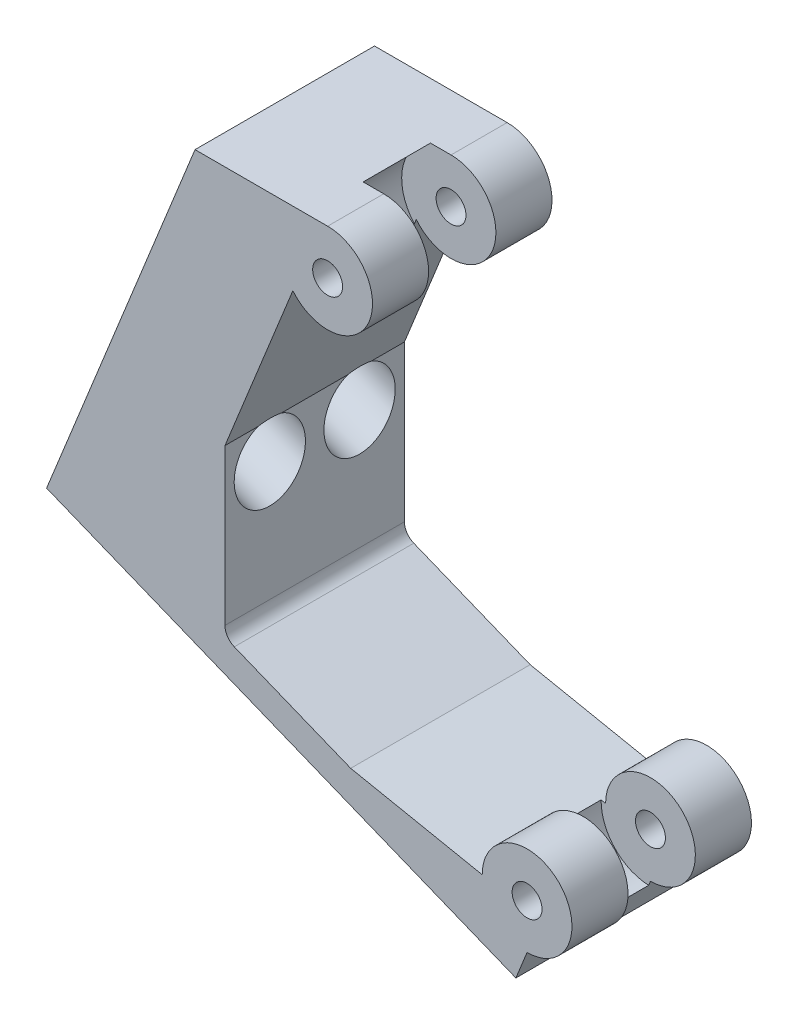
from build123d import *

# Parameters (mm, degrees)
SKETCH1_R                     = 1
BOSS_EXTRUDE1_DEPTH           = 12
CUT_EXTRUDE1_DEPTH            = 2.25
CUT_EXTRUDE1_DEPTH_BACK       = 2.25
SKETCH2_R                     = 3.3
FILLET3_R                     = 1
BOSS_EXTRUDE2_REACH           = 51.61
SKETCH4_W                     = 12
SKETCH4_H                     = 26.489515
SCREW_SHAFT_HOLES_DEPTH       = 42.118659
SCREW_SHAFT_HOLES_DEPTH_BACK  = 42.118659
HOLE_SKETCH_R                 = 1.288406
SCREW_COUNTERBORES_DEPTH      = 5
SCREW_COUNTERBORES_DEPTH_BACK = 2.591837
SKETCH5_R                     = 2.38125


with BuildPart() as part:
    # Sketch1 → Boss-Extrude1 (new body)
    with BuildSketch(Plane.XY):
        with BuildLine():
            Line((0, 6.64067), (0, 35.210533))
            Line((0, 35.210533), (8.86544, 35.210533))
            ThreePointArc((8.86544, 35.210533), (11.575609, 30.924071), (6.541088, 30.313855))
            Line((6.541088, 30.313855), (2, 19.074268))
            Line((2, 19.074268), (2, 7.989687))
            Line((2, 7.989687), (10.406939, 4.593064))
            Line((10.406939, 4.593064), (19.199233, 2.828667))
            ThreePointArc((19.199233, 2.828667), (24.320553, 4.949988), (22.199233, -0.171333))
            Line((22.199233, -0.171333), (21.45002, -2.0257))
            Line((21.45002, -2.0257), (0, 6.64067))
        make_face()
        with Locations((8.86544, 32.210533)):
            Circle(SKETCH1_R, mode=Mode.SUBTRACT)
        with Locations((22.199233, 2.828667)):
            Circle(SKETCH1_R, mode=Mode.SUBTRACT)
    extrude(amount=BOSS_EXTRUDE1_DEPTH)

    # Sketch2 → Cut-Extrude1 (cut, two sides: drawn at the far end of the back side and taken through both)
    with BuildSketch(Plane.XY.offset(6).offset(-CUT_EXTRUDE1_DEPTH_BACK)):
        with Locations((8.86544, 32.210533)):
            Circle(SKETCH2_R)
        with Locations((22.199233, 2.828667)):
            Circle(SKETCH2_R)
    extrude(amount=CUT_EXTRUDE1_DEPTH + CUT_EXTRUDE1_DEPTH_BACK, mode=Mode.SUBTRACT)

    # Fillet3
    fillet3_edges = [part.edges().sort_by_distance(p)[0] for p in [
        (2, 7.989687, 6),
    ]]
    fillet(fillet3_edges, radius=FILLET3_R)

    # Boss-Extrude2: up to this face of the body (flat: up to its plane)
    boss_extrude2_end = Plane(part.part.faces().sort_by_distance((0, 20.925601, 6))[0])
    # Sketch4 → Boss-Extrude2 (add, up to the picked face)
    with BuildSketch(Plane(origin=(-12.229646, 4.941098, 0), x_dir=(0, 0, -1), z_dir=(-0.9271838545667872, 0.37460659341591274, 0)), mode=Mode.PRIVATE) as boss_extrude2_sk1:
        with Locations((-6, -19.401879)):
            Rectangle(SKETCH4_W, SKETCH4_H)
    boss_extrude2_tool1 = split(extrude(boss_extrude2_sk1.sketch, amount=-BOSS_EXTRUDE2_REACH, mode=Mode.PRIVATE), bisect_by=boss_extrude2_end, keep=Keep.BOTH, mode=Mode.PRIVATE)
    add(boss_extrude2_tool1.solids().sort_by(Axis((-4.961574, 22.930207, 6), (0.9271838545667872, -0.37460659341591274, 0)))[0])

    # Hole sketch → Screw shaft holes (cut, two sides: drawn at the far end of the back side and taken through both)
    with BuildSketch(Plane(origin=(7.683612, 33.141702, 0), x_dir=(0, 0, -1), z_dir=(-0.927183854566786, 0.3746065934159158, 0)).offset(-SCREW_SHAFT_HOLES_DEPTH_BACK)):
        with Locations((-9, 17.420162)):
            Circle(HOLE_SKETCH_R)
        with Locations((-3, 17.420162)):
            Circle(HOLE_SKETCH_R)
        with Locations((-6, 6.887654)):
            Circle(HOLE_SKETCH_R)
    extrude(amount=SCREW_SHAFT_HOLES_DEPTH + SCREW_SHAFT_HOLES_DEPTH_BACK, mode=Mode.SUBTRACT)

    # Sketch5 → Screw counterbores (cut, two sides: drawn at the far end of the back side and taken through both)
    with BuildSketch(Plane(origin=(-4.90571, 1.982036, 0), x_dir=(0, 0, -1), z_dir=(0.927183854566786, -0.3746065934159158, 0)).offset(-SCREW_COUNTERBORES_DEPTH_BACK)):
        with Locations((-6, 26.719128)):
            Circle(SKETCH5_R)
        with Locations((-9, 16.18662)):
            Circle(SKETCH5_R)
        with Locations((-3, 16.18662)):
            Circle(SKETCH5_R)
    extrude(amount=SCREW_COUNTERBORES_DEPTH + SCREW_COUNTERBORES_DEPTH_BACK, mode=Mode.SUBTRACT)


solid = part.part
